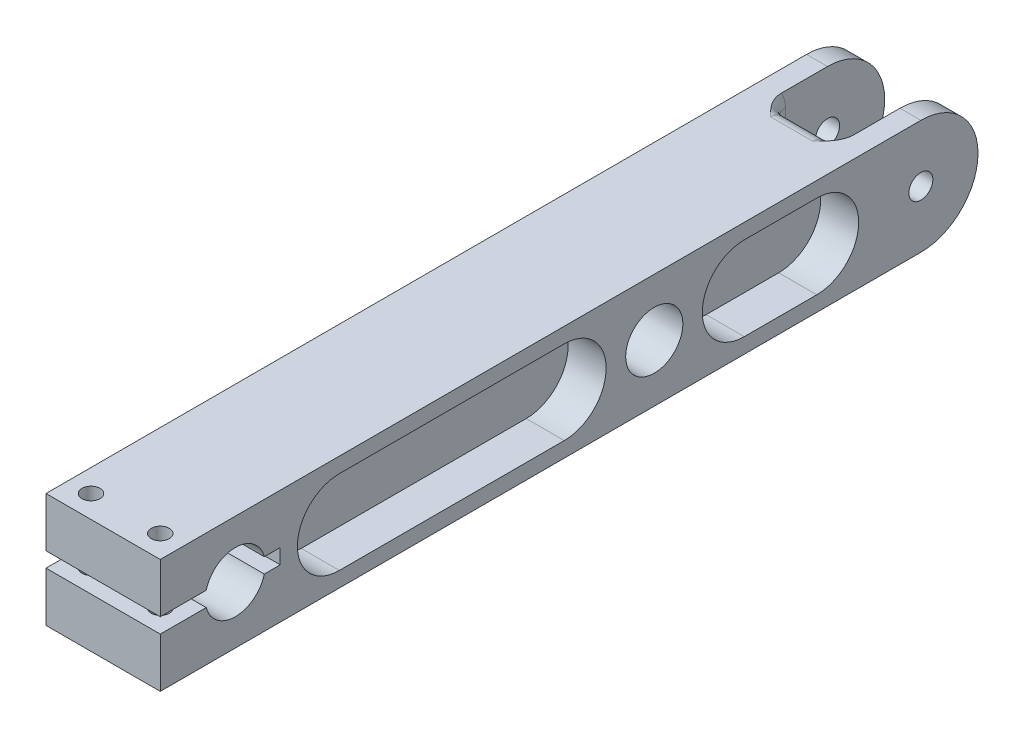
from build123d import *

# Parameters (mm, degrees)
SKETCH1_R           = 9.525
SKETCH1_R_2         = 4
BOSS_EXTRUDE1_DEPTH = 38.1
FILLET1_R           = 19.05
SKETCH2_W           = 24.13
SKETCH2_H           = 38.1
CUT_EXTRUDE1_DEPTH  = 254.443765952
CUT_EXTRUDE2_DEPTH  = 12.7
SKETCH4_R           = 3
CUT_EXTRUDE3_DEPTH  = 254.443765952
FILLET4_R           = 5
FILLET5_R           = 5


# Some blends are built 0.0001 mm under size
with BuildPart() as part:
    # Sketch1 → Boss-Extrude1 (new body)
    with BuildSketch(Plane(origin=(0, 0, 0), x_dir=(0, 0, -1), z_dir=(1, 0, 0))):
        with BuildLine():
            ThreePointArc((9.682458366, 16.55), (0, 9.05), (-9.682458366, 16.55))
            Line((-9.682458366, 16.55), (-25, 16.55))
            Line((-25, 16.55), (-25, 0))
            Line((-25, 0), (247.65, 0))
            Line((247.65, 0), (247.65, 38.1))
            Line((247.65, 38.1), (-25, 38.1))
            Line((-25, 38.1), (-25, 21.55))
            Line((-25, 21.55), (-9.682458366, 21.55))
            ThreePointArc((-9.682458366, 21.55), (0, 29.05), (9.682458366, 21.55))
            Line((9.682458366, 21.55), (15, 21.55))
            Line((15, 21.55), (15, 16.55))
            Line((15, 16.55), (9.682458366, 16.55))
        make_face()
        with Locations(Location((139.7, 19.05, 0), (0, 0, 180))):
            Circle(SKETCH1_R, mode=Mode.SUBTRACT)
        with Locations(Location((228.6, 19.05, 0), (0, 0, 180))):
            Circle(SKETCH1_R_2, mode=Mode.SUBTRACT)
    extrude(amount=BOSS_EXTRUDE1_DEPTH)

    # Fillet1
    fillet1_edges = [part.edges().sort_by_distance(p)[0] for p in [
        (19.05, 0, -247.65),
        (19.05, 38.1, -247.65),
    ]]
    fillet(fillet1_edges, radius=FILLET1_R - 0.0001)  # a hair under: the kernel refuses the full size

    # Sketch2 → Cut-Extrude1 (cut, through all)
    with BuildSketch(Plane(origin=(0, 38.1, 0), x_dir=(1, 0, 0), z_dir=(0, 1, 0))):
        with Locations((19.05, 228.6)):
            Rectangle(SKETCH2_W, SKETCH2_H)
    extrude(amount=-CUT_EXTRUDE1_DEPTH, mode=Mode.SUBTRACT)

    # Sketch3 → Cut-Extrude2 (cut)
    with BuildSketch(Plane(origin=(38.1, 0, 0), x_dir=(0, 0, -1), z_dir=(1, 0, 0))):
        with BuildLine():
            Line((34.7, 5.08), (109.7, 5.08))
            ThreePointArc((109.7, 5.08), (123.67, 19.05), (109.7, 33.02))
            Line((109.7, 33.02), (34.7, 33.02))
            ThreePointArc((34.7, 33.02), (20.73, 19.05), (34.7, 5.08))
        make_face()
        with BuildLine():
            Line((169.7, 5.08), (193.9, 5.08))
            ThreePointArc((193.9, 5.08), (207.87, 19.05), (193.9, 33.02))
            Line((193.9, 33.02), (169.7, 33.02))
            ThreePointArc((169.7, 33.02), (155.73, 19.05), (169.7, 5.08))
        make_face()
        with BuildLine():
            ThreePointArc((31.430916309, 19.05), (30.759207099, 25.513256042), (28.772789625, 31.700259965))
            ThreePointArc((28.772789625, 31.700259965), (20.73, 19.05), (28.772789625, 6.399740035))
            ThreePointArc((28.772789625, 6.399740035), (30.759207099, 12.586743958), (31.430916309, 19.05))
        make_face()
    cut_extrude2 = extrude(amount=-CUT_EXTRUDE2_DEPTH, mode=Mode.SUBTRACT)

    # Mirror1: Cut-Extrude2 across plane
    add(cut_extrude2.mirror(Plane(origin=(19.05, 0, 0), x_dir=(0, 0, 1), z_dir=(1, 0, 0))), mode=Mode.SUBTRACT)

    # Sketch4 → Cut-Extrude3 (cut, through all)
    with BuildSketch(Plane(origin=(0, 38.1, 0), x_dir=(1, 0, 0), z_dir=(0, 1, 0))):
        with Locations(Location((7.5, -17.5, 0), (0, 0, 270))):
            Circle(SKETCH4_R)
        with Locations(Location((30.6, -17.5, 0), (0, 0, 270))):
            Circle(SKETCH4_R)
    extrude(amount=-CUT_EXTRUDE3_DEPTH, mode=Mode.SUBTRACT)

    # Fillet4
    fillet4_edges = [part.edges().sort_by_distance(p)[0] for p in [
        (19.05, 38.1, -209.55),
        (19.05, 0, -209.55),
    ]]
    fillet(fillet4_edges, radius=FILLET4_R)

    # Fillet5
    # the kernel refuses this fillet: 5 mm, written as the material it adds along each edge
    with BuildSketch(Plane(origin=(31.115, 33.1, -209.55), x_dir=(-1, 0, 0), z_dir=(0, -1, 0))) as fillet5_piece_1:
        with BuildLine():
            CenterArc((FILLET5_R, FILLET5_R), FILLET5_R, 180, 90)
            Line((0, FILLET5_R), (0, 0))
            Line((0, 0), (FILLET5_R, 0))
        make_face()
    extrude(amount=28.1)
    with BuildSketch(Plane(origin=(6.985, 33.1, -209.55), x_dir=(1, 0, 0), z_dir=(0, -1, 0))) as fillet5_piece_2:
        with BuildLine():
            CenterArc((FILLET5_R, -FILLET5_R), FILLET5_R, 90, 90)
            Line((0, -FILLET5_R), (0, 0))
            Line((0, 0), (FILLET5_R, 0))
        make_face()
    extrude(amount=28.1)
    with BuildSketch(Plane(origin=(31.115, 5, -204.55), x_dir=(0, 0.8017442392976496, 0.597667277632826), z_dir=(0, 0.597667277632826, -0.8017442392976496))) as fillet5_piece_3_section:
        with BuildLine():
            CenterArc((5 + FILLET5_R, -FILLET5_R), FILLET5_R, 90, 90)
            Line((5 + FILLET5_R, 0), (5, 0))
            Line((5, 0), (5, -FILLET5_R))
        make_face()
    fillet5_piece_3 = revolve(axis=Axis((31.115, 5, -204.55), (1, 0, 0)), revolution_arc=233.296989237, mode=Mode.PRIVATE)
    fillet5_piece_3 = split(fillet5_piece_3, bisect_by=Plane(origin=(29.55685837, 0, -208.299694711), z_dir=(0, 1, 0)), keep=Keep.TOP, mode=Mode.PRIVATE)
    fillet5_piece_3 = fillet5_piece_3 - Plane(origin=(29.55685837, 19.05, -193.9), x_dir=(0, -1, 0), z_dir=(1, 0, 0)) * Cylinder(13.97, 41, mode=Mode.PRIVATE)
    add(fillet5_piece_3)
    with BuildSketch(Plane(origin=(6.985, 5, -204.55), x_dir=(0, 0.8017442392976496, 0.597667277632826), z_dir=(0, 0.597667277632826, -0.8017442392976496))) as fillet5_piece_4_section:
        with BuildLine():
            CenterArc((5 + FILLET5_R, FILLET5_R), FILLET5_R, 180, 90)
            Line((5, FILLET5_R), (5, 0))
            Line((5, 0), (5 + FILLET5_R, 0))
        make_face()
    fillet5_piece_4 = revolve(axis=Axis((6.985, 5, -204.55), (1, 0, 0)), revolution_arc=233.296989237, mode=Mode.PRIVATE)
    fillet5_piece_4 = split(fillet5_piece_4, bisect_by=Plane(origin=(8.543141587, 0, -208.299694664), z_dir=(0, 1, 0)), keep=Keep.TOP, mode=Mode.PRIVATE)
    fillet5_piece_4 = fillet5_piece_4 - Plane(origin=(8.543141587, 19.05, -193.9), x_dir=(0, -1, 0), z_dir=(-1, 0, 0)) * Cylinder(13.97, 41, mode=Mode.PRIVATE)
    add(fillet5_piece_4)
    with BuildSketch(Plane(origin=(31.115, 33.1, -204.55), x_dir=(0, 0, -1), z_dir=(0, -1, 0))) as fillet5_piece_5_section:
        with BuildLine():
            CenterArc((5 + FILLET5_R, -FILLET5_R), FILLET5_R, 90, 90)
            Line((5 + FILLET5_R, 0), (5, 0))
            Line((5, 0), (5, -FILLET5_R))
        make_face()
    fillet5_piece_5 = revolve(axis=Axis((31.115, 33.1, -204.55), (1, 0, 0)), revolution_arc=233.296989237, mode=Mode.PRIVATE)
    fillet5_piece_5 = split(fillet5_piece_5, bisect_by=Plane(origin=(29.556858367, 38.1, -208.299694701), z_dir=(0, -1, 0)), keep=Keep.TOP, mode=Mode.PRIVATE)
    fillet5_piece_5 = fillet5_piece_5 - Plane(origin=(29.556858367, 19.05, -193.9), x_dir=(0, -1, 0), z_dir=(1, 0, 0)) * Cylinder(13.97, 40, mode=Mode.PRIVATE)
    add(fillet5_piece_5)
    with BuildSketch(Plane(origin=(6.985, 33.1, -204.55), x_dir=(0, 0, -1), z_dir=(0, -1, 0))) as fillet5_piece_6_section:
        with BuildLine():
            CenterArc((5 + FILLET5_R, FILLET5_R), FILLET5_R, 180, 90)
            Line((5 + FILLET5_R, 0), (5, 0))
            Line((5, 0), (5, FILLET5_R))
        make_face()
    fillet5_piece_6 = revolve(axis=Axis((6.985, 33.1, -204.55), (1, 0, 0)), revolution_arc=233.296989237, mode=Mode.PRIVATE)
    fillet5_piece_6 = split(fillet5_piece_6, bisect_by=Plane(origin=(8.54314159, 38.1, -208.299694655), z_dir=(0, -1, 0)), keep=Keep.TOP, mode=Mode.PRIVATE)
    fillet5_piece_6 = fillet5_piece_6 - Plane(origin=(8.54314159, 19.05, -193.9), x_dir=(0, -1, 0), z_dir=(-1, 0, 0)) * Cylinder(13.97, 40, mode=Mode.PRIVATE)
    add(fillet5_piece_6)


solid = part.part
